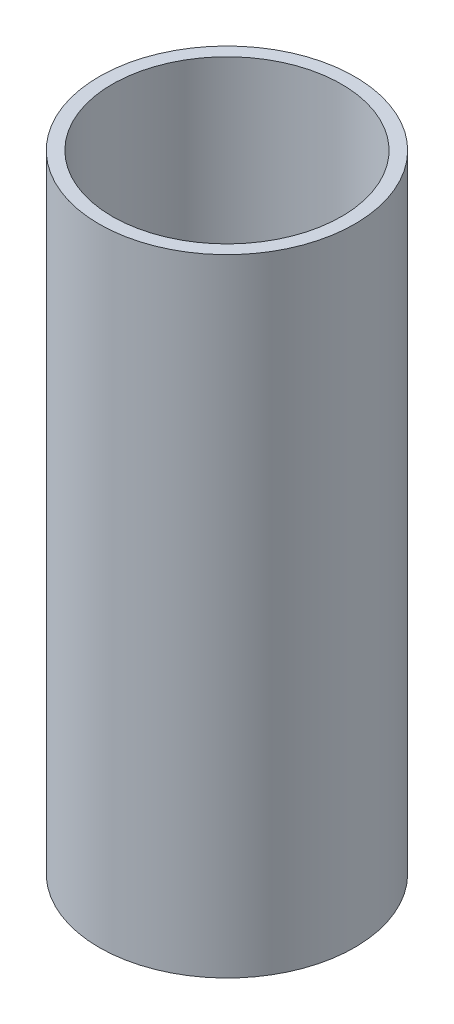
from build123d import *

# Parameters (mm, degrees)
SKETCH1_R           = 40
BOSS_EXTRUDE1_DEPTH = 196.09876828
SKETCH2_R           = 35.885008553
CUT_EXTRUDE1_DEPTH  = 205.094896852


with BuildPart() as part:
    # Sketch1 → Boss-Extrude1 (new body)
    with BuildSketch(Plane(origin=(0, 0, 0), x_dir=(1, 0, 0), z_dir=(0, 1, 0))):
        Circle(SKETCH1_R)
    extrude(amount=BOSS_EXTRUDE1_DEPTH)

    # Sketch2 → Cut-Extrude1 (cut, through all)
    with BuildSketch(Plane(origin=(0, 0, 0), x_dir=(1, 0, 0), z_dir=(0, 1, 0))):
        Circle(SKETCH2_R)
    extrude(amount=CUT_EXTRUDE1_DEPTH, mode=Mode.SUBTRACT)


solid = part.part
